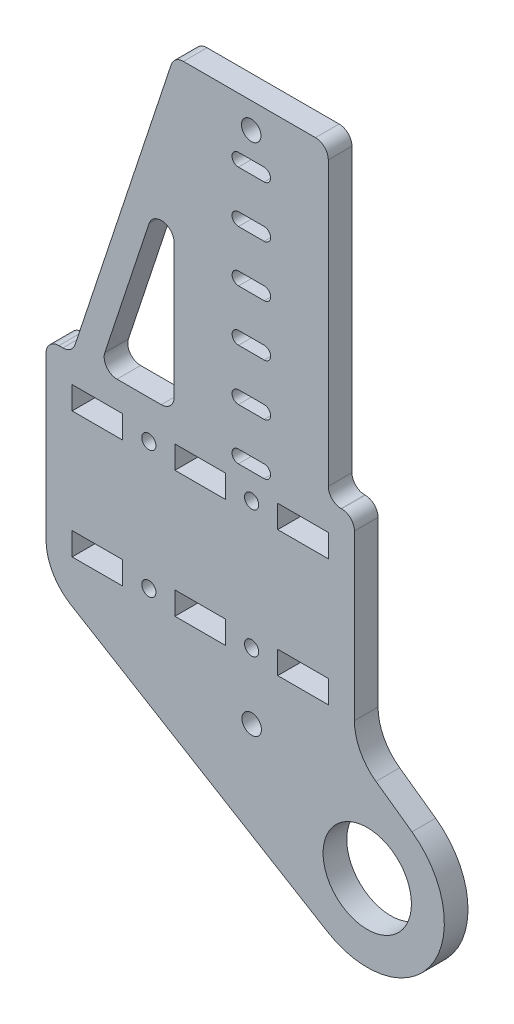
from build123d import *

# Parameters (mm, degrees)
SKETCH1_W           = 12.5
SKETCH1_H           = 5.642
SKETCH1_R           = 1.7526
SKETCH1_R_2         = 10.9125
SKETCH1_R_3         = 2.413
BOSS_EXTRUDE1_DEPTH = 5.842
FILLET1_R           = 3.175
FILLET2_R           = 3.175
FILLET3_R           = 3.175
SKETCH3_R           = 2.413
CUT_EXTRUDE2_DEPTH  = 119.085758265
CUT_EXTRUDE7_DEPTH  = 119.085758265
FILLET10_R          = 12.7
FILLET11_R          = 12.7


with BuildPart() as part:
    # Sketch1 → Boss-Extrude1 (new body)
    with BuildSketch(Plane.XY):
        with BuildLine():
            Line((38.1, -25.146), (38.1, -12.8))
            Line((38.1, -12.8), (38.1, 12.8))
            Line((38.1, 12.8), (38.1, 25.146))
            Line((38.1, 25.146), (31.65, 25.146))
            Line((31.65, 25.146), (31.65, 101.346))
            Line((31.65, 101.346), (-6.45, 101.346))
            Line((-6.45, 101.346), (-31.65, 25.146))
            Line((-31.65, 25.146), (-38.1, 25.146))
            Line((-38.1, 25.146), (-38.1, 12.8))
            Line((-38.1, 12.8), (-38.1, -12.8))
            Line((-38.1, -12.8), (-38.1, -25.146))
            Line((-38.1, -25.146), (31.431657464, -67.109846956))
            ThreePointArc((31.431657464, -67.109846956), (57.198562634, -61.256703737), (52.329925224, -35.285776581))
            Line((52.329925224, -35.285776581), (38.1, -25.146))
        make_face()
        with Locations((-25.4, -15.621)):
            Rectangle(SKETCH1_W, SKETCH1_H, mode=Mode.SUBTRACT)
        with Locations((-25.4, 15.621)):
            Rectangle(SKETCH1_W, SKETCH1_H, mode=Mode.SUBTRACT)
        with Locations((-12.7, -15.721)):
            Circle(SKETCH1_R, mode=Mode.SUBTRACT)
        with Locations((0, -15.621)):
            Rectangle(SKETCH1_W, SKETCH1_H, mode=Mode.SUBTRACT)
        with Locations((-12.7, 15.721)):
            Circle(SKETCH1_R, mode=Mode.SUBTRACT)
        with Locations((0, 15.621)):
            Rectangle(SKETCH1_W, SKETCH1_H, mode=Mode.SUBTRACT)
        with Locations((41.275, -50.8)):
            Circle(SKETCH1_R_2, mode=Mode.SUBTRACT)
        with Locations((12.7, -15.721)):
            Circle(SKETCH1_R, mode=Mode.SUBTRACT)
        with Locations((25.4, -15.621)):
            Rectangle(SKETCH1_W, SKETCH1_H, mode=Mode.SUBTRACT)
        with Locations((12.7, 15.721)):
            Circle(SKETCH1_R, mode=Mode.SUBTRACT)
        with Locations((25.4, 15.621)):
            Rectangle(SKETCH1_W, SKETCH1_H, mode=Mode.SUBTRACT)
        Polygon((-24.961764059, 25.146), (-6.45, 81.122048465), (-6.45, 25.146), align=None, mode=Mode.SUBTRACT)
        with Locations((12.6, 94.996)):
            Circle(SKETCH1_R_3, mode=Mode.SUBTRACT)
    extrude(amount=BOSS_EXTRUDE1_DEPTH)

    # Fillet1
    fillet1_edges = [part.edges().sort_by_distance(p)[0] for p in [
        (-38.1, 25.146, 2.921),
        (38.1, 25.146, 2.921),
        (-31.65, 25.146, 2.921),
        (31.65, 25.146, 2.921),
    ]]
    fillet(fillet1_edges, radius=FILLET1_R)

    # Fillet2
    fillet2_edges = [part.edges().sort_by_distance(p)[0] for p in [
        (-6.45, 25.146, 2.921),
        (-6.45, 81.122048465, 2.921),
        (-24.961764059, 25.146, 2.921),
    ]]
    fillet(fillet2_edges, radius=FILLET2_R)

    # Fillet3
    fillet3_edges = [part.edges().sort_by_distance(p)[0] for p in [
        (31.65, 101.346, 2.921),
        (-6.45, 101.346, 2.921),
    ]]
    fillet(fillet3_edges, radius=FILLET3_R)

    # Sketch3 → Cut-Extrude2 (cut, through all)
    with BuildSketch(Plane.XY.offset(5.842)):
        with Locations((12.714706865, -32.004)):
            Circle(SKETCH3_R)
    extrude(amount=-CUT_EXTRUDE2_DEPTH, mode=Mode.SUBTRACT)

    # Sketch11 → Cut-Extrude7 (cut, through all)
    with BuildSketch(Plane.XY.offset(5.842)):
        with BuildLine():
            Line((9.466989909, 63.296), (15.816989909, 63.296))
            ThreePointArc((15.816989909, 63.296), (17.404489909, 61.7085), (15.816989909, 60.121))
            Line((15.816989909, 60.121), (9.466989909, 60.121))
            ThreePointArc((9.466989909, 60.121), (7.879489909, 61.7085), (9.466989909, 63.296))
        make_face()
        with BuildLine():
            Line((9.45075517, 75.995989623), (15.80075517, 75.995989623))
            ThreePointArc((15.80075517, 75.995989623), (17.38825517, 74.408489623), (15.80075517, 72.820989623))
            Line((15.80075517, 72.820989623), (9.45075517, 72.820989623))
            ThreePointArc((9.45075517, 72.820989623), (7.86325517, 74.408489623), (9.45075517, 75.995989623))
        make_face()
        with BuildLine():
            Line((9.434520431, 88.695979247), (15.784520431, 88.695979247))
            ThreePointArc((15.784520431, 88.695979247), (17.372020431, 87.108479247), (15.784520431, 85.520979247))
            Line((15.784520431, 85.520979247), (9.434520431, 85.520979247))
            ThreePointArc((9.434520431, 85.520979247), (7.847020431, 87.108479247), (9.434520431, 88.695979247))
        make_face()
        with BuildLine():
            Line((9.434520431, 22.021020753), (15.784520431, 22.021020753))
            ThreePointArc((15.784520431, 22.021020753), (17.372020431, 23.608520753), (15.784520431, 25.196020753))
            Line((15.784520431, 25.196020753), (9.434520431, 25.196020753))
            ThreePointArc((9.434520431, 25.196020753), (7.847020431, 23.608520753), (9.434520431, 22.021020753))
        make_face()
        with BuildLine():
            Line((9.45075517, 34.721010377), (15.80075517, 34.721010377))
            ThreePointArc((15.80075517, 34.721010377), (17.38825517, 36.308510377), (15.80075517, 37.896010377))
            Line((15.80075517, 37.896010377), (9.45075517, 37.896010377))
            ThreePointArc((9.45075517, 37.896010377), (7.86325517, 36.308510377), (9.45075517, 34.721010377))
        make_face()
        with BuildLine():
            Line((9.466989909, 47.421), (15.816989909, 47.421))
            ThreePointArc((15.816989909, 47.421), (17.404489909, 49.0085), (15.816989909, 50.596))
            Line((15.816989909, 50.596), (9.466989909, 50.596))
            ThreePointArc((9.466989909, 50.596), (7.879489909, 49.0085), (9.466989909, 47.421))
        make_face()
    extrude(amount=-CUT_EXTRUDE7_DEPTH, mode=Mode.SUBTRACT)

    # Fillet10
    fillet10_edges = [part.edges().sort_by_distance(p)[0] for p in [
        (-38.1, -25.146, 2.921),
    ]]
    fillet(fillet10_edges, radius=FILLET10_R)

    # Fillet11
    fillet11_edges = [part.edges().sort_by_distance(p)[0] for p in [
        (38.1, -25.146, 2.921),
    ]]
    fillet(fillet11_edges, radius=FILLET11_R)


solid = part.part
